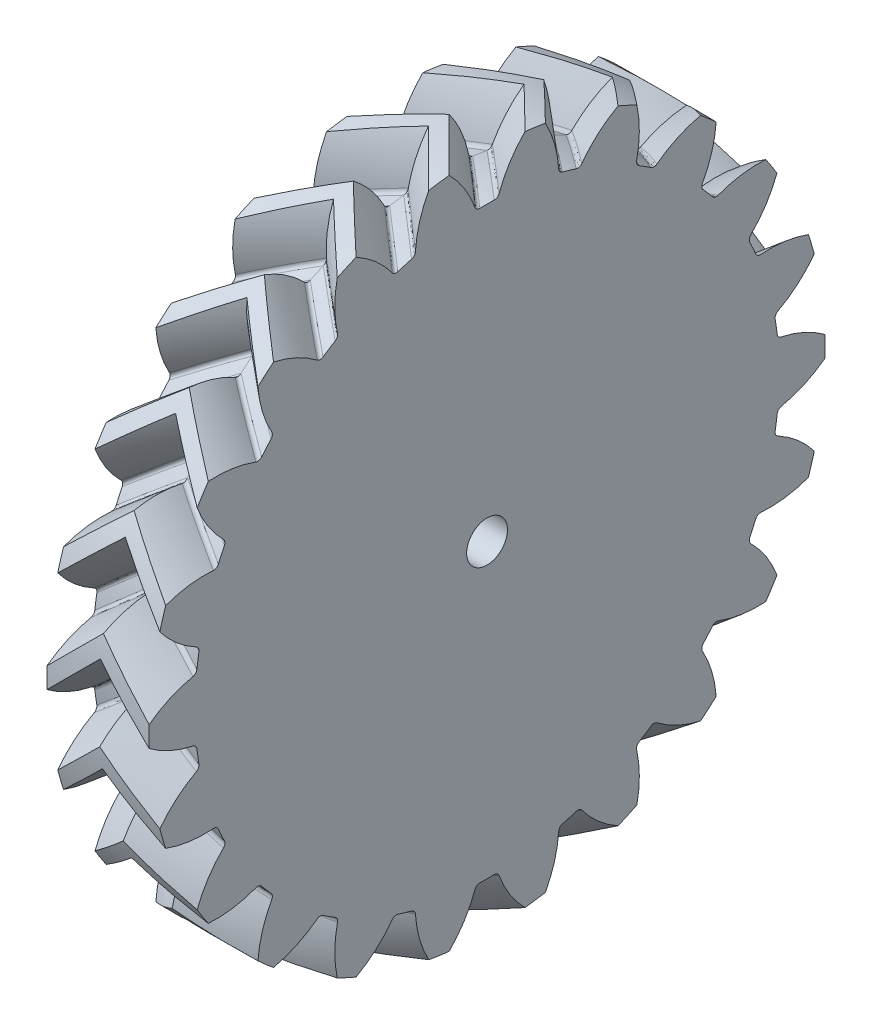
from build123d import *

# Parameters (mm, degrees)
BASPROSKE_W            = 5
BASPROSKE_H            = 33.112698372
TOOTHCUTLH_PITCH       = 208.053219893
TOOTHCUTLH_HEIGHT      = 5
TOOTHCUTLH_RADIUS      = 33.112698372
TOOTHCUTLH_START_ANGLE = -90
TEETHCUTSLH_COUNT      = 22
TEETHCUTSLH_ANGLE      = 343.636363636
BORSKE_R               = 2
BORE_DEPTH             = 62.5000025


with BuildPart() as part:
    # BasProSke → Base-Revolve (revolve)
    with BuildSketch(Plane(origin=(0, 0, 0), x_dir=(1, 0, 0), z_dir=(0, 1, 0)), mode=Mode.PRIVATE) as base_revolve_sk:
        with Locations((2.5, 16.556349186)):
            Rectangle(BASPROSKE_W, BASPROSKE_H)
    revolve(base_revolve_sk.sketch.rotate(Axis((-10, 0, 0), (1, 0, 0)), 180), axis=Axis((-10, 0, 0), (1, 0, 0)))

    # ToothCutLH: sweep along a helix
    with BuildLine() as toothcutlh_path:
        add(Helix(TOOTHCUTLH_PITCH, TOOTHCUTLH_HEIGHT, TOOTHCUTLH_RADIUS, center=(0, 0, 0), direction=(1, 0, 0), lefthand=True, mode=Mode.PRIVATE).rotate(Axis((0, 0, 0), (1, 0, 0)), TOOTHCUTLH_START_ANGLE))
    # TooCutSkeRH<3> → ToothCutLH (sweep, cut)
    with BuildSketch(Plane(origin=(0, 0, 0), x_dir=(0, 0, -1), z_dir=(1, 0, 0))):
        with BuildLine():
            ThreePointArc((0.700908122, 28.604112221), (0, 28.612698372), (-0.700908122, 28.604112221))
            ThreePointArc((-0.700908122, 28.604112221), (-0.995143629, 28.690838742), (-1.183676055, 28.932813011))
            ThreePointArc((-1.183676055, 28.932813011), (-2.601497, 31.600490661), (-4.691558504, 33.781857936))
            ThreePointArc((-4.691558504, 33.781857936), (0, 34.106079323), (4.691558504, 33.781857936))
            ThreePointArc((4.691558504, 33.781857936), (2.601497, 31.600490661), (1.183676055, 28.932813011))
            ThreePointArc((1.183676055, 28.932813011), (0.995143629, 28.690838742), (0.700908122, 28.604112221))
        make_face()
    toothcutlh = sweep(path=toothcutlh_path.line, is_frenet=True, mode=Mode.SUBTRACT)

    # TeethCutsLH: ToothCutLH ×22 about axis
    teethcutslh_axis = Axis((-10, 0, 0), (1, 0, 0))
    for i in range(1, TEETHCUTSLH_COUNT):
        add(toothcutlh.rotate(teethcutslh_axis, i * TEETHCUTSLH_ANGLE / (TEETHCUTSLH_COUNT - 1)), mode=Mode.SUBTRACT)

    # BorSke → Bore (cut, symmetric)
    with BuildSketch(Plane(origin=(0, 0, 0), x_dir=(0, 0, -1), z_dir=(1, 0, 0))):
        with Locations(Location((0, 0, 0), (0, 0, 180))):
            Circle(BORSKE_R)
    extrude(amount=BORE_DEPTH, both=True, mode=Mode.SUBTRACT)

    # Simetría1: part across plane


with BuildPart() as part_1:
    add(part.part)
    add(part.part.mirror(Plane.ZY.offset(-5)))


solid = part_1.part
